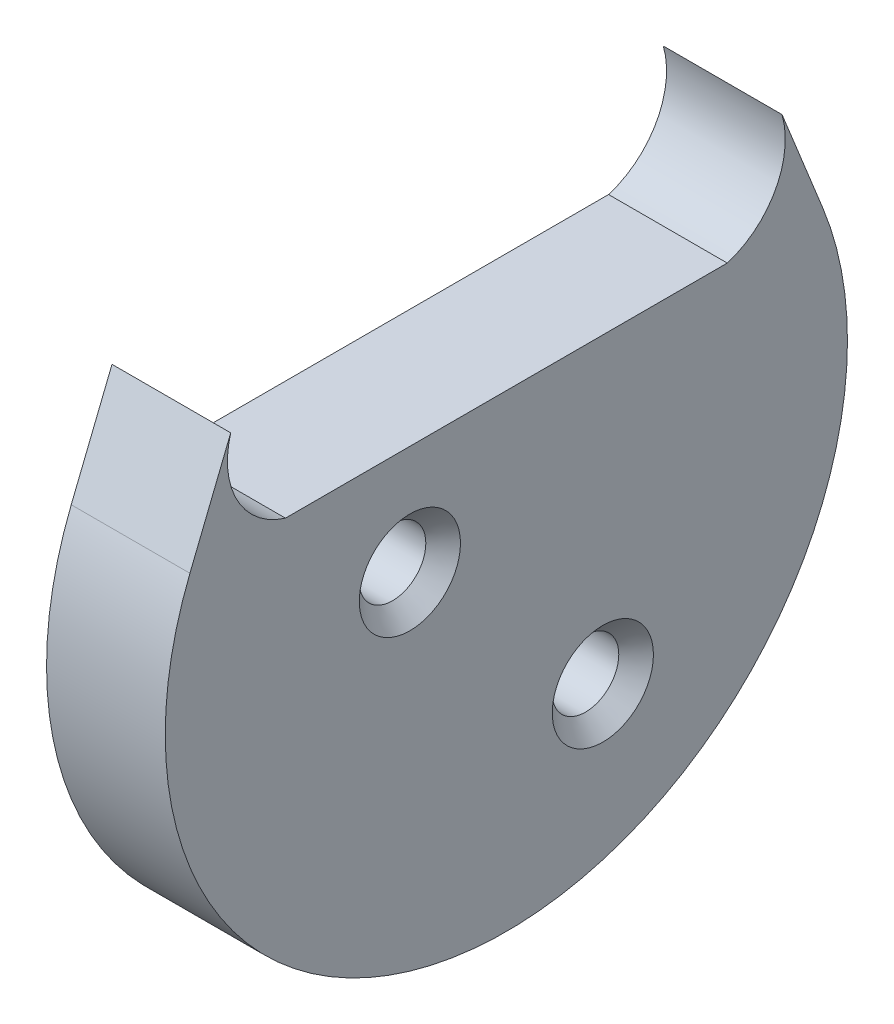
from build123d import *

# Parameters (mm, degrees)
BOSS_EXTRUDE1_DEPTH             = 2.175
F_2_CLEARANCE_HOLE2_D           = 2.4384
F_2_CLEARANCE_HOLE2_CSINK_D     = 3.7084
F_2_CLEARANCE_HOLE2_CSINK_ANGLE = 90


with BuildPart() as part:
    # Sketch1 → Boss-Extrude1 (new, symmetric)
    with BuildSketch(Plane(origin=(0, 0, 0), x_dir=(0, 0, -1), z_dir=(1, 0, 0))):
        with BuildLine():
            Line((-10.101597565, 8.379005111), (-11.5955, 4.668445111))
            ThreePointArc((-11.5955, 4.668445111), (0, -12.5), (11.5955, 4.668445111))
            Line((11.5955, 4.668445111), (10.101597565, 8.379005111))
            ThreePointArc((10.101597565, 8.379005111), (9.860779562, 6.11162847), (8.0955, 4.668445111))
            Line((8.0955, 4.668445111), (-8.0955, 4.668445111))
            ThreePointArc((-8.0955, 4.668445111), (-9.860779562, 6.11162847), (-10.101597565, 8.379005111))
        make_face()
    extrude(amount=BOSS_EXTRUDE1_DEPTH, both=True)

    # #2 Clearance Hole2 (through all)
    with Locations(Plane(origin=(2.175, 0.668445111, 3.535533906), x_dir=(0, 0, 1), z_dir=(1, 0, 0))):
        with Locations((0, 0), (-7.071067812, 7.071067812)):
            CounterSinkHole(F_2_CLEARANCE_HOLE2_D / 2, F_2_CLEARANCE_HOLE2_CSINK_D / 2, counter_sink_angle=F_2_CLEARANCE_HOLE2_CSINK_ANGLE)


solid = part.part
